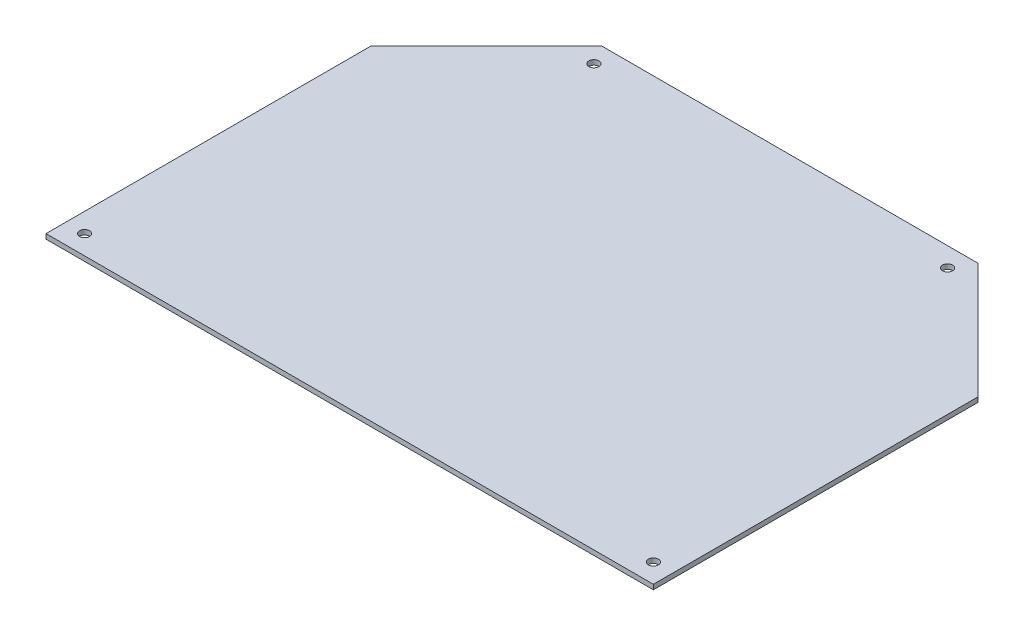
from build123d import *

# Parameters (mm, degrees)
SKETCH2_W                = 400
SKETCH2_H                = 290
BASE_FLANGE1_DEPTH       = 3.175
CUT_EXTRUDE1_DEPTH       = 10
M6_CLEARANCE_HOLE1_D     = 6.6
M6_CLEARANCE_HOLE1_DEPTH = 18.75
M6_CLEARANCE_HOLE1_TIP   = 1.982840043


# Sheet-metal steps are written as plain solids
with BuildPart() as part:
    # Sketch2 (on Top Plane) → Base-Flange1 (new body)
    with BuildSketch(Plane(origin=(0, 0, 0), x_dir=(1, 0, 0), z_dir=(0, 1, 0))):
        Rectangle(SKETCH2_W, SKETCH2_H)
    extrude(amount=-BASE_FLANGE1_DEPTH)

    # Sketch10 → Cut-Extrude1 (cut)
    with BuildSketch(Plane(origin=(0, 0, 0), x_dir=(1, 0, 0), z_dir=(0, 1, 0))):
        Polygon((200, 68.8), (200, 145), (123.8, 145), align=None)
        Polygon((-200, 145), (-123.8, 145), (-200, 68.8), align=None)
    extrude(amount=-CUT_EXTRUDE1_DEPTH, mode=Mode.SUBTRACT)

    # M6 Clearance Hole1
    with Locations(Plane(origin=(0, 0, 0), x_dir=(1, 0, 0), z_dir=(0, 1, 0))):
        with Locations((-187.3, -132.3), (187.3, -132.3), (116.467651581, 132.3), (-116.467651581, 132.3)):
            Hole(M6_CLEARANCE_HOLE1_D / 2, depth=M6_CLEARANCE_HOLE1_DEPTH)
            with Locations((0, 0, -(M6_CLEARANCE_HOLE1_DEPTH + M6_CLEARANCE_HOLE1_TIP / 2))):  # 118° drill point
                Cone(0, M6_CLEARANCE_HOLE1_D / 2, M6_CLEARANCE_HOLE1_TIP, mode=Mode.SUBTRACT)


solid = part.part
